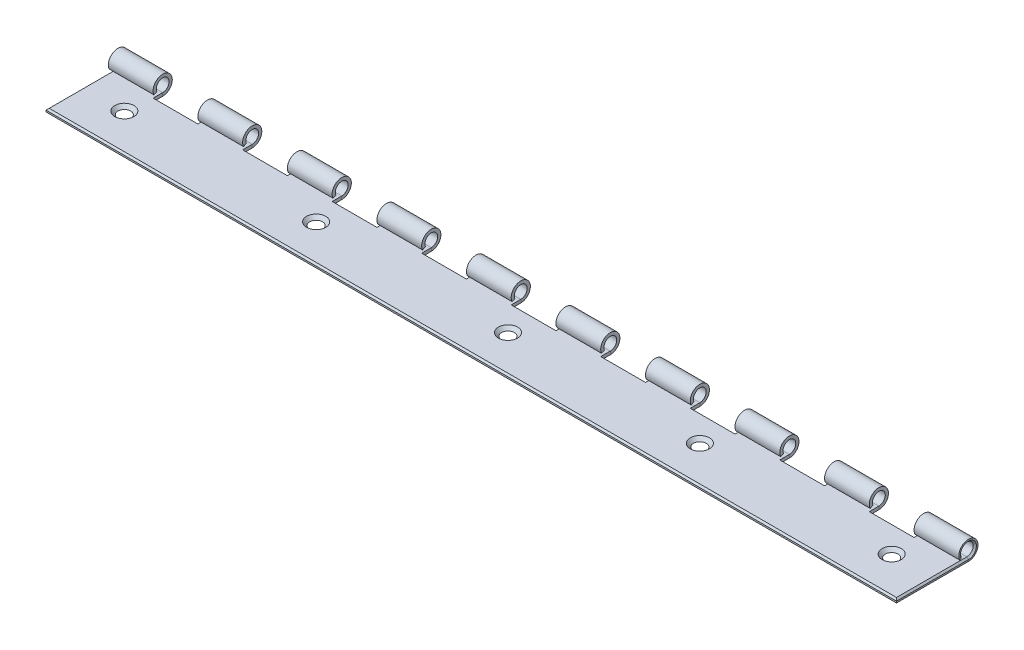
from build123d import *

# Parameters (mm, degrees)
SKETCH1_W          = 266
SKETCH1_H          = 25.5
BASE_FLANGE1_DEPTH = 1
HEM1_START         = -133
HEM1_DEPTH         = 266
HEM1_2_DEPTH       = 266
CUT_EXTRUDE1_START = -134.703262862
SKETCH8_W          = 14
SKETCH8_H          = 6
CUT_EXTRUDE1_DEPTH = 259.406525724
LPATTERN1_COUNT    = 11
LPATTERN1_PITCH    = 28
CHAMFER1_SIZE      = 0.5
SKETCH9_R          = 2
CUT_EXTRUDE2_DEPTH = 10
LPATTERN2_COUNT    = 5
LPATTERN2_PITCH    = 60
CHAMFER2_SIZE      = 1


# Read off the part's stored shape, not the designer's step: Hem1
# Sheet-metal steps are written as plain solids
with BuildPart() as part:
    # Sketch1 → Base-Flange1 (new body)
    with BuildSketch(Plane(origin=(0, 0, 0), x_dir=(1, 0, 0), z_dir=(0, 1, 0))):
        Rectangle(SKETCH1_W, SKETCH1_H)
    extrude(amount=-BASE_FLANGE1_DEPTH)

    # Hem1 outline → Hem1 (cut)
    with BuildSketch(Plane.YZ.offset(HEM1_START)):
        with BuildLine():
            Line((0, -12.75), (0, -11.986067977))
            ThreePointArc((0, -11.986067977), (-0.738612788, -10.974744871), (-1, -9.75))
            Line((-1, -9.75), (-1, -12.75))
            Line((-1, -12.75), (0, -12.75))
        make_face()
    extrude(amount=HEM1_DEPTH, mode=Mode.SUBTRACT)

    # Hem1 2 outline → Hem1 2 (add)
    with BuildSketch(Plane.YZ.offset(HEM1_START)):
        with BuildLine():
            Line((0.732145215, -7.031076639), (1.154763477, -7.937384426))
            ThreePointArc((1.154763477, -7.937384426), (3.686782892, -10.824599218), (0, -9.75))
            Line((0, -9.75), (0, -11.986067977))
            ThreePointArc((0, -11.986067977), (4.967777538, -10.18851623), (0.732145215, -7.031076639))
        make_face()
    extrude(amount=HEM1_2_DEPTH)

    # Sketch8 → Cut-Extrude1 (cut)
    with BuildSketch(Plane(origin=(0, 0, 0), x_dir=(1, 0, 0), z_dir=(0, 1, 0)).offset(CUT_EXTRUDE1_START)):
        with Locations((112, 9.75)):
            Rectangle(SKETCH8_W, SKETCH8_H)
    cut_extrude1 = extrude(amount=CUT_EXTRUDE1_DEPTH, mode=Mode.SUBTRACT)

    # LPattern1: Cut-Extrude1 ×11
    with Locations(*[(-i * LPATTERN1_PITCH, 0, 0) for i in range(1, LPATTERN1_COUNT)]):
        add(cut_extrude1, mode=Mode.SUBTRACT)

    # Chamfer1
    chamfer1_edges = [part.edges().sort_by_distance(p)[0] for p in [
        (-133, 0, 1.5),
        (133, 3.686782892, -10.824599218),
        (-133, 3.686782892, -10.824599218),
        (-133, 0, 1.5),
        (0, 0, 12.75),
        (133, 0, 1.5),
    ]]
    chamfer(chamfer1_edges, length=CHAMFER1_SIZE)

    # Sketch9 → Cut-Extrude2 (cut)
    with BuildSketch(Plane(origin=(0, 0, 0), x_dir=(1, 0, 0), z_dir=(0, 1, 0))):
        with Locations(Location((-120, -1.25, 0), (0, 0, 270))):
            Circle(SKETCH9_R)
    cut_extrude2 = extrude(amount=-CUT_EXTRUDE2_DEPTH, mode=Mode.SUBTRACT)

    # LPattern2: Cut-Extrude2 ×5
    with Locations(*[(i * LPATTERN2_PITCH, 0, 0) for i in range(1, LPATTERN2_COUNT)]):
        add(cut_extrude2, mode=Mode.SUBTRACT)

    # Chamfer2
    chamfer2_edges = [part.edges().sort_by_distance(p)[0] for p in [
        (-120, 0, -0.75),
        (-60, 0, -0.75),
        (0, 0, -0.75),
        (60, 0, -0.75),
        (120, 0, -0.75),
    ]]
    chamfer(chamfer2_edges, length=CHAMFER2_SIZE - 0.0001)  # a hair under: the kernel refuses the full size


solid = part.part
